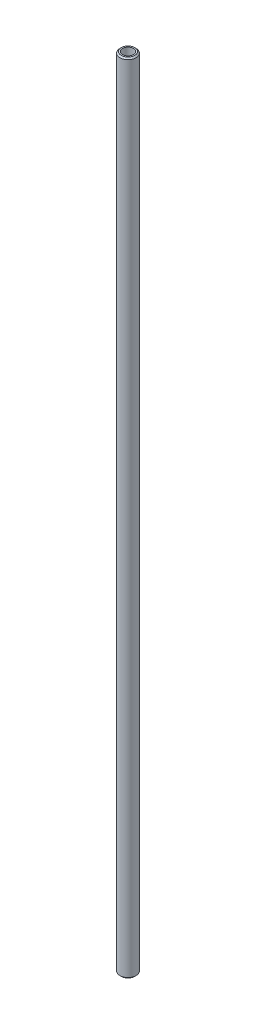
from build123d import *

# Parameters (mm, degrees)
ESQUISSE2_R        = 3
ESQUISSE2_R_2      = 2
BOSS_EXTRU_1_DEPTH = 295
CHANFREIN1_SIZE    = 0.5


with BuildPart() as part:
    # Esquisse2 → Boss.-Extru.1 (new body)
    with BuildSketch(Plane(origin=(0, 0, 0), x_dir=(1, 0, 0), z_dir=(0, 1, 0))):
        with Locations((2011.565547097, -372.060338688)):
            Circle(ESQUISSE2_R)
        with Locations((2011.565547097, -372.060338688)):
            Circle(ESQUISSE2_R_2, mode=Mode.SUBTRACT)
    extrude(amount=BOSS_EXTRU_1_DEPTH)

    # Chanfrein1
    chanfrein1_edges = [part.edges().sort_by_distance(p)[0] for p in [
        (2008.565547097, 295, 372.060338688),
        (2008.565547097, 0, 372.060338688),
    ]]
    chamfer(chanfrein1_edges, length=CHANFREIN1_SIZE)


solid = part.part
